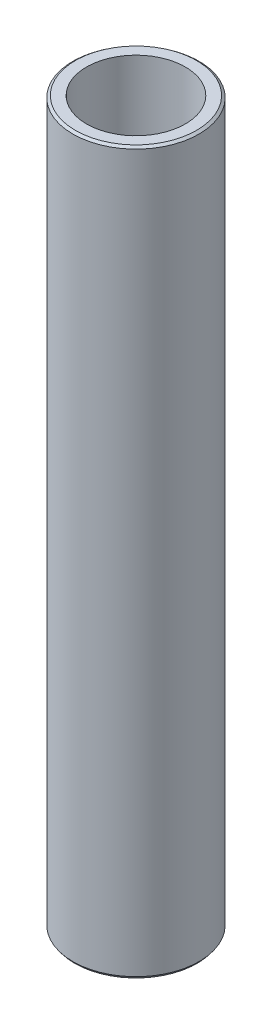
from build123d import *
from OCP.BRepFilletAPI import BRepFilletAPI_MakeChamfer

# Parameters (mm, degrees)
SKETCH1_R           = 52.5
BOSS_EXTRUDE1_DEPTH = 600
SKETCH2_R           = 41.111927437
CUT_EXTRUDE1_DEPTH  = 605.576297914
CHAMFER1_SIZE       = 1.584962038
CHAMFER1_SIZE2      = 2.096796002


with BuildPart() as part:
    # Sketch1 → Boss-Extrude1 (new body)
    with BuildSketch(Plane(origin=(0, 0, 0), x_dir=(1, 0, 0), z_dir=(0, 1, 0))):
        Circle(SKETCH1_R)
    extrude(amount=BOSS_EXTRUDE1_DEPTH)

    # Sketch2 → Cut-Extrude1 (cut, through all)
    with BuildSketch(Plane(origin=(0, 0, 0), x_dir=(1, 0, 0), z_dir=(0, 1, 0))):
        Circle(SKETCH2_R)
    extrude(amount=CUT_EXTRUDE1_DEPTH, mode=Mode.SUBTRACT)

    # Chamfer1: one chamfer whose edges measure the first distance from different faces: ONE call of the kernel's chamfer builder (chamfer() names one face for all edges)
    chamfer1_edges_1 = [part.edges().sort_by_distance(p)[0] for p in [
        (-52.5, 600, 0),
    ]]
    chamfer1_side_1 = [part.faces().sort_by_distance(p)[0] for p in [
        (-52.5, 300, 0),
    ]]
    chamfer1_edges_2 = [part.edges().sort_by_distance(p)[0] for p in [
        (-52.5, 0, 0),
    ]]
    chamfer1_side_2 = [part.faces().sort_by_distance(p)[0] for p in [
        (-51.01507576, 0, 0),
    ]]
    chamfer1 = BRepFilletAPI_MakeChamfer(part.part.solid().wrapped)
    for e in chamfer1_edges_1:
        chamfer1.Add(CHAMFER1_SIZE, CHAMFER1_SIZE2, e.wrapped, chamfer1_side_1[0].wrapped)  # the first distance lies on this face
    for e in chamfer1_edges_2:
        chamfer1.Add(CHAMFER1_SIZE, CHAMFER1_SIZE2, e.wrapped, chamfer1_side_2[0].wrapped)  # the first distance lies on this face
    add(Compound.cast(chamfer1.Shape()), mode=Mode.REPLACE)


solid = part.part
